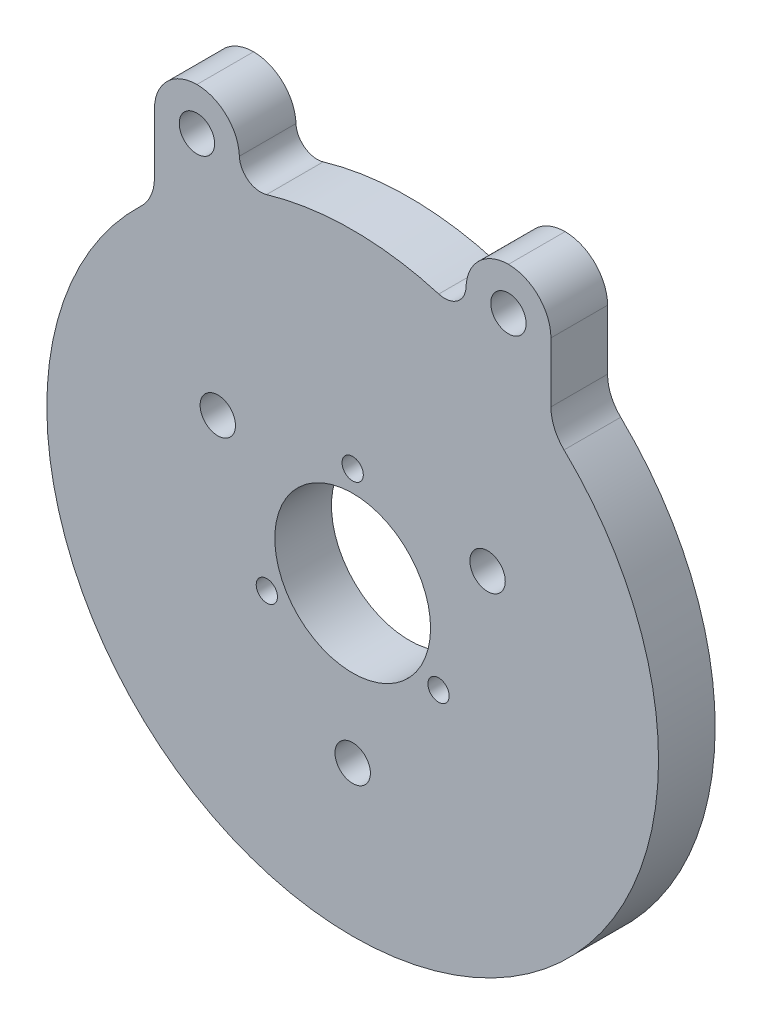
from build123d import *

# Parameters (mm, degrees)
SKETCH1_R         = 21.6
EXTRUDE1_DEPTH    = 4
EXTRUDE2_START    = -4
SKETCH2_R         = 1.25
EXTRUDE2_DEPTH    = 4
FILLET1_R         = 3
FILLET2_R         = 1.5
SKETCH3_R         = 5.5
EXTRUDE3_DEPTH    = 4
SKETCH4_R         = 0.75
EXTRUDE4_DEPTH    = 4
CIRPATTERN1_COUNT = 3
SKETCH5_R         = 1.25
EXTRUDE5_DEPTH    = 4
CIRPATTERN2_COUNT = 3


with BuildPart() as part:
    # Sketch1 → Extrude1 (new body)
    with BuildSketch(Plane.XY):
        Circle(SKETCH1_R)
    extrude(amount=EXTRUDE1_DEPTH)

    # Sketch2 → Extrude2 (add)
    # profile 1 of 2: a face of its own
    with BuildSketch(Plane.XY.offset(4).offset(EXTRUDE2_START)):
        with BuildLine():
            Line((8, 25), (8, 20.063897926))
            ThreePointArc((8, 20.063897926), (11.147528841, 18.501151335), (14, 16.448708156))
            Line((14, 16.448708156), (14, 25))
            Line((14, 25), (8, 25))
        make_face()
        with Locations((11, 22)):
            Circle(SKETCH2_R, mode=Mode.SUBTRACT)
    # profile 2 of 2: a face of its own
    with BuildSketch(Plane.XY.offset(4).offset(EXTRUDE2_START)):
        with BuildLine():
            Line((-14, 25), (-14, 16.448708156))
            ThreePointArc((-14, 16.448708156), (-11.147528841, 18.501151335), (-8, 20.063897926))
            Line((-8, 20.063897926), (-8, 25))
            Line((-8, 25), (-14, 25))
        make_face()
        with Locations((-11, 22)):
            Circle(SKETCH2_R, mode=Mode.SUBTRACT)
    extrude(amount=EXTRUDE2_DEPTH)

    # Fillet1
    fillet1_edges = [part.edges().sort_by_distance(p)[0] for p in [
        (14, 16.448708156, 2),
        (-14, 16.448708156, 2),
        (14, 25, 2),
        (8, 25, 2),
        (-8, 25, 2),
        (-14, 25, 2),
    ]]
    fillet(fillet1_edges, radius=FILLET1_R - 0.0001)  # a hair under: the kernel refuses the full size

    # Fillet2
    fillet2_edges = [part.edges().sort_by_distance(p)[0] for p in [
        (8, 20.063897926, 2),
        (-8, 20.063897926, 2),
    ]]
    fillet(fillet2_edges, radius=FILLET2_R)

    # Sketch3 → Extrude3 (cut)
    with BuildSketch(Plane.XY.offset(4)):
        Circle(SKETCH3_R)
    extrude(amount=-EXTRUDE3_DEPTH, mode=Mode.SUBTRACT)

    # Sketch4 → Extrude4 (cut)
    with BuildSketch(Plane.XY.offset(4)):
        with Locations((0, 7)):
            Circle(SKETCH4_R)
    extrude4 = extrude(amount=-EXTRUDE4_DEPTH, mode=Mode.SUBTRACT)

    # CirPattern1: Extrude4 ×3 about axis
    cirpattern1_axis = Axis((0, 0, 0), (0, 0, 1))
    for i in range(1, CIRPATTERN1_COUNT):
        add(extrude4.rotate(cirpattern1_axis, i * 360 / CIRPATTERN1_COUNT), mode=Mode.SUBTRACT)

    # Sketch5 → Extrude5 (cut)
    with BuildSketch(Plane.XY.offset(4)):
        with Locations((0, -11)):
            Circle(SKETCH5_R)
    extrude5 = extrude(amount=-EXTRUDE5_DEPTH, mode=Mode.SUBTRACT)

    # CirPattern2: Extrude5 ×3 about axis
    cirpattern2_axis = Axis((0, 0, 0), (0, 0, 1))
    for i in range(1, CIRPATTERN2_COUNT):
        add(extrude5.rotate(cirpattern2_axis, i * 360 / CIRPATTERN2_COUNT), mode=Mode.SUBTRACT)


solid = part.part
